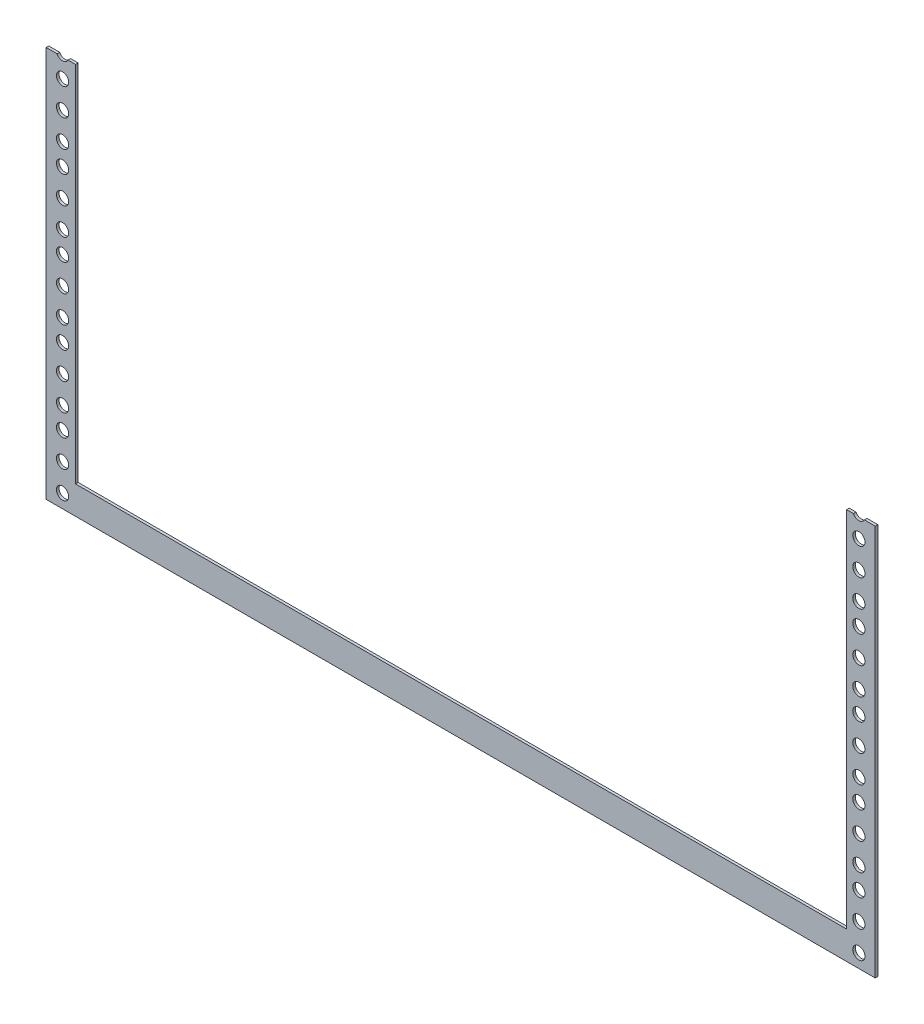
from build123d import *

# Parameters (mm, degrees)
SKETCH1_W          = 484.1875
SKETCH1_H          = 1958.975
SKETCH1_R          = 3.571875
SKETCH1_W_2        = 450.402529245
SKETCH1_H_2        = 1922.114390918
BASE_FLANGE1_DEPTH = 1.524
SKETCH2_W          = 484.1875
SKETCH2_H          = 1730.375
EXTRUDE1_DEPTH     = 2129.3640217


# Sheet-metal steps are written as plain solids
with BuildPart() as part:
    # Sketch1 → Base-Flange1 (new body)
    with BuildSketch(Plane.XY):
        with Locations((0, 1135.0625)):
            Rectangle(SKETCH1_W, SKETCH1_H)
        with Locations(Location((-232.56875, 284.1625, 0), (0, 0, 180))):
            Circle(SKETCH1_R, mode=Mode.SUBTRACT)
        with Locations(Location((-232.56875, 239.7125, 0), (0, 0, 180))):
            Circle(SKETCH1_R, mode=Mode.SUBTRACT)
        with Locations(Location((-232.56875, 252.4125, 0), (0, 0, 180))):
            Circle(SKETCH1_R, mode=Mode.SUBTRACT)
        with Locations(Location((-232.56875, 268.2875, 0), (0, 0, 180))):
            Circle(SKETCH1_R, mode=Mode.SUBTRACT)
        with Locations(Location((-232.56875, 207.9625, 0), (0, 0, 180))):
            Circle(SKETCH1_R, mode=Mode.SUBTRACT)
        with Locations(Location((-232.56875, 195.2625, 0), (0, 0, 180))):
            Circle(SKETCH1_R, mode=Mode.SUBTRACT)
        with Locations(Location((-232.56875, 179.3875, 0), (0, 0, 180))):
            Circle(SKETCH1_R, mode=Mode.SUBTRACT)
        with Locations(Location((-232.56875, 163.5125, 0), (0, 0, 180))):
            Circle(SKETCH1_R, mode=Mode.SUBTRACT)
        with Locations(Location((-232.56875, 223.8375, 0), (0, 0, 180))):
            Circle(SKETCH1_R, mode=Mode.SUBTRACT)
        with Locations(Location((-232.56875, 417.5125, 0), (0, 0, 180))):
            Circle(SKETCH1_R, mode=Mode.SUBTRACT)
        with Locations(Location((-232.56875, 401.6375, 0), (0, 0, 180))):
            Circle(SKETCH1_R, mode=Mode.SUBTRACT)
        with Locations(Location((-232.56875, 373.0625, 0), (0, 0, 180))):
            Circle(SKETCH1_R, mode=Mode.SUBTRACT)
        with Locations(Location((-232.56875, 385.7625, 0), (0, 0, 180))):
            Circle(SKETCH1_R, mode=Mode.SUBTRACT)
        with Locations(Location((-232.56875, 312.7375, 0), (0, 0, 180))):
            Circle(SKETCH1_R, mode=Mode.SUBTRACT)
        with Locations(Location((-232.56875, 296.8625, 0), (0, 0, 180))):
            Circle(SKETCH1_R, mode=Mode.SUBTRACT)
        with Locations(Location((-232.56875, 328.6125, 0), (0, 0, 180))):
            Circle(SKETCH1_R, mode=Mode.SUBTRACT)
        with Locations(Location((-232.56875, 341.3125, 0), (0, 0, 180))):
            Circle(SKETCH1_R, mode=Mode.SUBTRACT)
        with Locations(Location((-232.56875, 357.1875, 0), (0, 0, 180))):
            Circle(SKETCH1_R, mode=Mode.SUBTRACT)
        with Locations(Location((-232.56875, 506.4125, 0), (0, 0, 180))):
            Circle(SKETCH1_R, mode=Mode.SUBTRACT)
        with Locations(Location((-232.56875, 534.9875, 0), (0, 0, 180))):
            Circle(SKETCH1_R, mode=Mode.SUBTRACT)
        with Locations(Location((-232.56875, 519.1125, 0), (0, 0, 180))):
            Circle(SKETCH1_R, mode=Mode.SUBTRACT)
        with Locations(Location((-232.56875, 446.0875, 0), (0, 0, 180))):
            Circle(SKETCH1_R, mode=Mode.SUBTRACT)
        with Locations(Location((-232.56875, 461.9625, 0), (0, 0, 180))):
            Circle(SKETCH1_R, mode=Mode.SUBTRACT)
        with Locations(Location((-232.56875, 430.2125, 0), (0, 0, 180))):
            Circle(SKETCH1_R, mode=Mode.SUBTRACT)
        with Locations(Location((-232.56875, 474.6625, 0), (0, 0, 180))):
            Circle(SKETCH1_R, mode=Mode.SUBTRACT)
        with Locations(Location((-232.56875, 490.5375, 0), (0, 0, 180))):
            Circle(SKETCH1_R, mode=Mode.SUBTRACT)
        with Locations(Location((232.56875, 284.1625, 0), (0, 0, 180))):
            Circle(SKETCH1_R, mode=Mode.SUBTRACT)
        with Locations(Location((232.56875, 239.7125, 0), (0, 0, 180))):
            Circle(SKETCH1_R, mode=Mode.SUBTRACT)
        with Locations(Location((232.56875, 252.4125, 0), (0, 0, 180))):
            Circle(SKETCH1_R, mode=Mode.SUBTRACT)
        with Locations(Location((232.56875, 268.2875, 0), (0, 0, 180))):
            Circle(SKETCH1_R, mode=Mode.SUBTRACT)
        with Locations(Location((232.56875, 207.9625, 0), (0, 0, 180))):
            Circle(SKETCH1_R, mode=Mode.SUBTRACT)
        with Locations(Location((232.56875, 179.3875, 0), (0, 0, 180))):
            Circle(SKETCH1_R, mode=Mode.SUBTRACT)
        with Locations(Location((232.56875, 195.2625, 0), (0, 0, 180))):
            Circle(SKETCH1_R, mode=Mode.SUBTRACT)
        with Locations(Location((232.56875, 163.5125, 0), (0, 0, 180))):
            Circle(SKETCH1_R, mode=Mode.SUBTRACT)
        with Locations(Location((232.56875, 223.8375, 0), (0, 0, 180))):
            Circle(SKETCH1_R, mode=Mode.SUBTRACT)
        with Locations(Location((232.56875, 417.5125, 0), (0, 0, 180))):
            Circle(SKETCH1_R, mode=Mode.SUBTRACT)
        with Locations(Location((232.56875, 401.6375, 0), (0, 0, 180))):
            Circle(SKETCH1_R, mode=Mode.SUBTRACT)
        with Locations(Location((232.56875, 373.0625, 0), (0, 0, 180))):
            Circle(SKETCH1_R, mode=Mode.SUBTRACT)
        with Locations(Location((232.56875, 385.7625, 0), (0, 0, 180))):
            Circle(SKETCH1_R, mode=Mode.SUBTRACT)
        with Locations(Location((232.56875, 312.7375, 0), (0, 0, 180))):
            Circle(SKETCH1_R, mode=Mode.SUBTRACT)
        with Locations(Location((232.56875, 296.8625, 0), (0, 0, 180))):
            Circle(SKETCH1_R, mode=Mode.SUBTRACT)
        with Locations(Location((232.56875, 328.6125, 0), (0, 0, 180))):
            Circle(SKETCH1_R, mode=Mode.SUBTRACT)
        with Locations(Location((232.56875, 357.1875, 0), (0, 0, 180))):
            Circle(SKETCH1_R, mode=Mode.SUBTRACT)
        with Locations(Location((232.56875, 341.3125, 0), (0, 0, 180))):
            Circle(SKETCH1_R, mode=Mode.SUBTRACT)
        with Locations(Location((232.56875, 506.4125, 0), (0, 0, 180))):
            Circle(SKETCH1_R, mode=Mode.SUBTRACT)
        with Locations(Location((232.56875, 534.9875, 0), (0, 0, 180))):
            Circle(SKETCH1_R, mode=Mode.SUBTRACT)
        with Locations(Location((232.56875, 519.1125, 0), (0, 0, 180))):
            Circle(SKETCH1_R, mode=Mode.SUBTRACT)
        with Locations(Location((232.56875, 461.9625, 0), (0, 0, 180))):
            Circle(SKETCH1_R, mode=Mode.SUBTRACT)
        with Locations(Location((232.56875, 446.0875, 0), (0, 0, 180))):
            Circle(SKETCH1_R, mode=Mode.SUBTRACT)
        with Locations(Location((232.56875, 430.2125, 0), (0, 0, 180))):
            Circle(SKETCH1_R, mode=Mode.SUBTRACT)
        with Locations(Location((232.56875, 474.6625, 0), (0, 0, 180))):
            Circle(SKETCH1_R, mode=Mode.SUBTRACT)
        with Locations(Location((232.56875, 490.5375, 0), (0, 0, 180))):
            Circle(SKETCH1_R, mode=Mode.SUBTRACT)
        with Locations(Location((-232.56875, 801.6875, 0), (0, 0, 180))):
            Circle(SKETCH1_R, mode=Mode.SUBTRACT)
        with Locations(Location((-232.56875, 639.7625, 0), (0, 0, 180))):
            Circle(SKETCH1_R, mode=Mode.SUBTRACT)
        with Locations(Location((-232.56875, 652.4625, 0), (0, 0, 180))):
            Circle(SKETCH1_R, mode=Mode.SUBTRACT)
        with Locations(Location((-232.56875, 668.3375, 0), (0, 0, 180))):
            Circle(SKETCH1_R, mode=Mode.SUBTRACT)
        with Locations(Location((-232.56875, 550.8625, 0), (0, 0, 180))):
            Circle(SKETCH1_R, mode=Mode.SUBTRACT)
        with Locations(Location((-232.56875, 579.4375, 0), (0, 0, 180))):
            Circle(SKETCH1_R, mode=Mode.SUBTRACT)
        with Locations(Location((-232.56875, 595.3125, 0), (0, 0, 180))):
            Circle(SKETCH1_R, mode=Mode.SUBTRACT)
        with Locations(Location((-232.56875, 563.5625, 0), (0, 0, 180))):
            Circle(SKETCH1_R, mode=Mode.SUBTRACT)
        with Locations(Location((-232.56875, 608.0125, 0), (0, 0, 180))):
            Circle(SKETCH1_R, mode=Mode.SUBTRACT)
        with Locations(Location((-232.56875, 623.8875, 0), (0, 0, 180))):
            Circle(SKETCH1_R, mode=Mode.SUBTRACT)
        with Locations(Location((-232.56875, 757.2375, 0), (0, 0, 180))):
            Circle(SKETCH1_R, mode=Mode.SUBTRACT)
        with Locations(Location((-232.56875, 773.1125, 0), (0, 0, 180))):
            Circle(SKETCH1_R, mode=Mode.SUBTRACT)
        with Locations(Location((-232.56875, 785.8125, 0), (0, 0, 180))):
            Circle(SKETCH1_R, mode=Mode.SUBTRACT)
        with Locations(Location((-232.56875, 712.7875, 0), (0, 0, 180))):
            Circle(SKETCH1_R, mode=Mode.SUBTRACT)
        with Locations(Location((-232.56875, 684.2125, 0), (0, 0, 180))):
            Circle(SKETCH1_R, mode=Mode.SUBTRACT)
        with Locations(Location((-232.56875, 696.9125, 0), (0, 0, 180))):
            Circle(SKETCH1_R, mode=Mode.SUBTRACT)
        with Locations(Location((-232.56875, 728.6625, 0), (0, 0, 180))):
            Circle(SKETCH1_R, mode=Mode.SUBTRACT)
        with Locations(Location((-232.56875, 741.3625, 0), (0, 0, 180))):
            Circle(SKETCH1_R, mode=Mode.SUBTRACT)
        with Locations(Location((-232.56875, 935.0375, 0), (0, 0, 180))):
            Circle(SKETCH1_R, mode=Mode.SUBTRACT)
        with Locations(Location((-232.56875, 906.4625, 0), (0, 0, 180))):
            Circle(SKETCH1_R, mode=Mode.SUBTRACT)
        with Locations(Location((-232.56875, 919.1625, 0), (0, 0, 180))):
            Circle(SKETCH1_R, mode=Mode.SUBTRACT)
        with Locations(Location((-232.56875, 890.5875, 0), (0, 0, 180))):
            Circle(SKETCH1_R, mode=Mode.SUBTRACT)
        with Locations(Location((-232.56875, 830.2625, 0), (0, 0, 180))):
            Circle(SKETCH1_R, mode=Mode.SUBTRACT)
        with Locations(Location((-232.56875, 817.5625, 0), (0, 0, 180))):
            Circle(SKETCH1_R, mode=Mode.SUBTRACT)
        with Locations(Location((-232.56875, 846.1375, 0), (0, 0, 180))):
            Circle(SKETCH1_R, mode=Mode.SUBTRACT)
        with Locations(Location((-232.56875, 862.0125, 0), (0, 0, 180))):
            Circle(SKETCH1_R, mode=Mode.SUBTRACT)
        with Locations(Location((-232.56875, 874.7125, 0), (0, 0, 180))):
            Circle(SKETCH1_R, mode=Mode.SUBTRACT)
        with Locations(Location((-232.56875, 1052.5125, 0), (0, 0, 180))):
            Circle(SKETCH1_R, mode=Mode.SUBTRACT)
        with Locations(Location((-232.56875, 1023.9375, 0), (0, 0, 180))):
            Circle(SKETCH1_R, mode=Mode.SUBTRACT)
        with Locations(Location((-232.56875, 1039.8125, 0), (0, 0, 180))):
            Circle(SKETCH1_R, mode=Mode.SUBTRACT)
        with Locations(Location((-232.56875, 950.9125, 0), (0, 0, 180))):
            Circle(SKETCH1_R, mode=Mode.SUBTRACT)
        with Locations(Location((-232.56875, 963.6125, 0), (0, 0, 180))):
            Circle(SKETCH1_R, mode=Mode.SUBTRACT)
        with Locations(Location((-232.56875, 979.4875, 0), (0, 0, 180))):
            Circle(SKETCH1_R, mode=Mode.SUBTRACT)
        with Locations(Location((-232.56875, 995.3625, 0), (0, 0, 180))):
            Circle(SKETCH1_R, mode=Mode.SUBTRACT)
        with Locations(Location((-232.56875, 1008.0625, 0), (0, 0, 180))):
            Circle(SKETCH1_R, mode=Mode.SUBTRACT)
        with Locations(Location((232.56875, 801.6875, 0), (0, 0, 180))):
            Circle(SKETCH1_R, mode=Mode.SUBTRACT)
        with Locations(Location((232.56875, 639.7625, 0), (0, 0, 180))):
            Circle(SKETCH1_R, mode=Mode.SUBTRACT)
        with Locations(Location((232.56875, 652.4625, 0), (0, 0, 180))):
            Circle(SKETCH1_R, mode=Mode.SUBTRACT)
        with Locations(Location((232.56875, 668.3375, 0), (0, 0, 180))):
            Circle(SKETCH1_R, mode=Mode.SUBTRACT)
        with Locations(Location((232.56875, 550.8625, 0), (0, 0, 180))):
            Circle(SKETCH1_R, mode=Mode.SUBTRACT)
        with Locations(Location((232.56875, 595.3125, 0), (0, 0, 180))):
            Circle(SKETCH1_R, mode=Mode.SUBTRACT)
        with Locations(Location((232.56875, 579.4375, 0), (0, 0, 180))):
            Circle(SKETCH1_R, mode=Mode.SUBTRACT)
        with Locations(Location((232.56875, 563.5625, 0), (0, 0, 180))):
            Circle(SKETCH1_R, mode=Mode.SUBTRACT)
        with Locations(Location((232.56875, 608.0125, 0), (0, 0, 180))):
            Circle(SKETCH1_R, mode=Mode.SUBTRACT)
        with Locations(Location((232.56875, 623.8875, 0), (0, 0, 180))):
            Circle(SKETCH1_R, mode=Mode.SUBTRACT)
        with Locations(Location((232.56875, 773.1125, 0), (0, 0, 180))):
            Circle(SKETCH1_R, mode=Mode.SUBTRACT)
        with Locations(Location((232.56875, 757.2375, 0), (0, 0, 180))):
            Circle(SKETCH1_R, mode=Mode.SUBTRACT)
        with Locations(Location((232.56875, 785.8125, 0), (0, 0, 180))):
            Circle(SKETCH1_R, mode=Mode.SUBTRACT)
        with Locations(Location((232.56875, 712.7875, 0), (0, 0, 180))):
            Circle(SKETCH1_R, mode=Mode.SUBTRACT)
        with Locations(Location((232.56875, 684.2125, 0), (0, 0, 180))):
            Circle(SKETCH1_R, mode=Mode.SUBTRACT)
        with Locations(Location((232.56875, 696.9125, 0), (0, 0, 180))):
            Circle(SKETCH1_R, mode=Mode.SUBTRACT)
        with Locations(Location((232.56875, 728.6625, 0), (0, 0, 180))):
            Circle(SKETCH1_R, mode=Mode.SUBTRACT)
        with Locations(Location((232.56875, 741.3625, 0), (0, 0, 180))):
            Circle(SKETCH1_R, mode=Mode.SUBTRACT)
        with Locations(Location((232.56875, 935.0375, 0), (0, 0, 180))):
            Circle(SKETCH1_R, mode=Mode.SUBTRACT)
        with Locations(Location((232.56875, 906.4625, 0), (0, 0, 180))):
            Circle(SKETCH1_R, mode=Mode.SUBTRACT)
        with Locations(Location((232.56875, 919.1625, 0), (0, 0, 180))):
            Circle(SKETCH1_R, mode=Mode.SUBTRACT)
        with Locations(Location((232.56875, 890.5875, 0), (0, 0, 180))):
            Circle(SKETCH1_R, mode=Mode.SUBTRACT)
        with Locations(Location((232.56875, 830.2625, 0), (0, 0, 180))):
            Circle(SKETCH1_R, mode=Mode.SUBTRACT)
        with Locations(Location((232.56875, 817.5625, 0), (0, 0, 180))):
            Circle(SKETCH1_R, mode=Mode.SUBTRACT)
        with Locations(Location((232.56875, 862.0125, 0), (0, 0, 180))):
            Circle(SKETCH1_R, mode=Mode.SUBTRACT)
        with Locations(Location((232.56875, 846.1375, 0), (0, 0, 180))):
            Circle(SKETCH1_R, mode=Mode.SUBTRACT)
        with Locations(Location((232.56875, 874.7125, 0), (0, 0, 180))):
            Circle(SKETCH1_R, mode=Mode.SUBTRACT)
        with Locations(Location((232.56875, 1052.5125, 0), (0, 0, 180))):
            Circle(SKETCH1_R, mode=Mode.SUBTRACT)
        with Locations(Location((232.56875, 1039.8125, 0), (0, 0, 180))):
            Circle(SKETCH1_R, mode=Mode.SUBTRACT)
        with Locations(Location((232.56875, 1023.9375, 0), (0, 0, 180))):
            Circle(SKETCH1_R, mode=Mode.SUBTRACT)
        with Locations(Location((232.56875, 950.9125, 0), (0, 0, 180))):
            Circle(SKETCH1_R, mode=Mode.SUBTRACT)
        with Locations(Location((232.56875, 995.3625, 0), (0, 0, 180))):
            Circle(SKETCH1_R, mode=Mode.SUBTRACT)
        with Locations(Location((232.56875, 979.4875, 0), (0, 0, 180))):
            Circle(SKETCH1_R, mode=Mode.SUBTRACT)
        with Locations(Location((232.56875, 963.6125, 0), (0, 0, 180))):
            Circle(SKETCH1_R, mode=Mode.SUBTRACT)
        with Locations(Location((232.56875, 1008.0625, 0), (0, 0, 180))):
            Circle(SKETCH1_R, mode=Mode.SUBTRACT)
        with Locations(Location((-232.56875, 1319.2125, 0), (0, 0, 180))):
            Circle(SKETCH1_R, mode=Mode.SUBTRACT)
        with Locations(Location((-232.56875, 1157.2875, 0), (0, 0, 180))):
            Circle(SKETCH1_R, mode=Mode.SUBTRACT)
        with Locations(Location((-232.56875, 1173.1625, 0), (0, 0, 180))):
            Circle(SKETCH1_R, mode=Mode.SUBTRACT)
        with Locations(Location((-232.56875, 1185.8625, 0), (0, 0, 180))):
            Circle(SKETCH1_R, mode=Mode.SUBTRACT)
        with Locations(Location((-232.56875, 1128.7125, 0), (0, 0, 180))):
            Circle(SKETCH1_R, mode=Mode.SUBTRACT)
        with Locations(Location((-232.56875, 1096.9625, 0), (0, 0, 180))):
            Circle(SKETCH1_R, mode=Mode.SUBTRACT)
        with Locations(Location((-232.56875, 1068.3875, 0), (0, 0, 180))):
            Circle(SKETCH1_R, mode=Mode.SUBTRACT)
        with Locations(Location((-232.56875, 1084.2625, 0), (0, 0, 180))):
            Circle(SKETCH1_R, mode=Mode.SUBTRACT)
        with Locations(Location((-232.56875, 1112.8375, 0), (0, 0, 180))):
            Circle(SKETCH1_R, mode=Mode.SUBTRACT)
        with Locations(Location((-232.56875, 1141.4125, 0), (0, 0, 180))):
            Circle(SKETCH1_R, mode=Mode.SUBTRACT)
        with Locations(Location((-232.56875, 1274.7625, 0), (0, 0, 180))):
            Circle(SKETCH1_R, mode=Mode.SUBTRACT)
        with Locations(Location((-232.56875, 1290.6375, 0), (0, 0, 180))):
            Circle(SKETCH1_R, mode=Mode.SUBTRACT)
        with Locations(Location((-232.56875, 1306.5125, 0), (0, 0, 180))):
            Circle(SKETCH1_R, mode=Mode.SUBTRACT)
        with Locations(Location((-232.56875, 1246.1875, 0), (0, 0, 180))):
            Circle(SKETCH1_R, mode=Mode.SUBTRACT)
        with Locations(Location((-232.56875, 1262.0625, 0), (0, 0, 180))):
            Circle(SKETCH1_R, mode=Mode.SUBTRACT)
        with Locations(Location((-232.56875, 1201.7375, 0), (0, 0, 180))):
            Circle(SKETCH1_R, mode=Mode.SUBTRACT)
        with Locations(Location((-232.56875, 1217.6125, 0), (0, 0, 180))):
            Circle(SKETCH1_R, mode=Mode.SUBTRACT)
        with Locations(Location((-232.56875, 1230.3125, 0), (0, 0, 180))):
            Circle(SKETCH1_R, mode=Mode.SUBTRACT)
        with Locations(Location((-232.56875, 1452.5625, 0), (0, 0, 180))):
            Circle(SKETCH1_R, mode=Mode.SUBTRACT)
        with Locations(Location((-232.56875, 1408.1125, 0), (0, 0, 180))):
            Circle(SKETCH1_R, mode=Mode.SUBTRACT)
        with Locations(Location((-232.56875, 1423.9875, 0), (0, 0, 180))):
            Circle(SKETCH1_R, mode=Mode.SUBTRACT)
        with Locations(Location((-232.56875, 1439.8625, 0), (0, 0, 180))):
            Circle(SKETCH1_R, mode=Mode.SUBTRACT)
        with Locations(Location((-232.56875, 1379.5375, 0), (0, 0, 180))):
            Circle(SKETCH1_R, mode=Mode.SUBTRACT)
        with Locations(Location((-232.56875, 1350.9625, 0), (0, 0, 180))):
            Circle(SKETCH1_R, mode=Mode.SUBTRACT)
        with Locations(Location((-232.56875, 1363.6625, 0), (0, 0, 180))):
            Circle(SKETCH1_R, mode=Mode.SUBTRACT)
        with Locations(Location((-232.56875, 1335.0875, 0), (0, 0, 180))):
            Circle(SKETCH1_R, mode=Mode.SUBTRACT)
        with Locations(Location((-232.56875, 1395.4125, 0), (0, 0, 180))):
            Circle(SKETCH1_R, mode=Mode.SUBTRACT)
        with Locations(Location((-232.56875, 1573.2125, 0), (0, 0, 180))):
            Circle(SKETCH1_R, mode=Mode.SUBTRACT)
        with Locations(Location((-232.56875, 1541.4625, 0), (0, 0, 180))):
            Circle(SKETCH1_R, mode=Mode.SUBTRACT)
        with Locations(Location((-232.56875, 1557.3375, 0), (0, 0, 180))):
            Circle(SKETCH1_R, mode=Mode.SUBTRACT)
        with Locations(Location((-232.56875, 1497.0125, 0), (0, 0, 180))):
            Circle(SKETCH1_R, mode=Mode.SUBTRACT)
        with Locations(Location((-232.56875, 1468.4375, 0), (0, 0, 180))):
            Circle(SKETCH1_R, mode=Mode.SUBTRACT)
        with Locations(Location((-232.56875, 1484.3125, 0), (0, 0, 180))):
            Circle(SKETCH1_R, mode=Mode.SUBTRACT)
        with Locations(Location((-232.56875, 1512.8875, 0), (0, 0, 180))):
            Circle(SKETCH1_R, mode=Mode.SUBTRACT)
        with Locations(Location((-232.56875, 1528.7625, 0), (0, 0, 180))):
            Circle(SKETCH1_R, mode=Mode.SUBTRACT)
        with Locations(Location((232.56875, 1319.2125, 0), (0, 0, 180))):
            Circle(SKETCH1_R, mode=Mode.SUBTRACT)
        with Locations(Location((232.56875, 1157.2875, 0), (0, 0, 180))):
            Circle(SKETCH1_R, mode=Mode.SUBTRACT)
        with Locations(Location((232.56875, 1173.1625, 0), (0, 0, 180))):
            Circle(SKETCH1_R, mode=Mode.SUBTRACT)
        with Locations(Location((232.56875, 1185.8625, 0), (0, 0, 180))):
            Circle(SKETCH1_R, mode=Mode.SUBTRACT)
        with Locations(Location((232.56875, 1128.7125, 0), (0, 0, 180))):
            Circle(SKETCH1_R, mode=Mode.SUBTRACT)
        with Locations(Location((232.56875, 1084.2625, 0), (0, 0, 180))):
            Circle(SKETCH1_R, mode=Mode.SUBTRACT)
        with Locations(Location((232.56875, 1068.3875, 0), (0, 0, 180))):
            Circle(SKETCH1_R, mode=Mode.SUBTRACT)
        with Locations(Location((232.56875, 1096.9625, 0), (0, 0, 180))):
            Circle(SKETCH1_R, mode=Mode.SUBTRACT)
        with Locations(Location((232.56875, 1112.8375, 0), (0, 0, 180))):
            Circle(SKETCH1_R, mode=Mode.SUBTRACT)
        with Locations(Location((232.56875, 1141.4125, 0), (0, 0, 180))):
            Circle(SKETCH1_R, mode=Mode.SUBTRACT)
        with Locations(Location((232.56875, 1274.7625, 0), (0, 0, 180))):
            Circle(SKETCH1_R, mode=Mode.SUBTRACT)
        with Locations(Location((232.56875, 1306.5125, 0), (0, 0, 180))):
            Circle(SKETCH1_R, mode=Mode.SUBTRACT)
        with Locations(Location((232.56875, 1290.6375, 0), (0, 0, 180))):
            Circle(SKETCH1_R, mode=Mode.SUBTRACT)
        with Locations(Location((232.56875, 1262.0625, 0), (0, 0, 180))):
            Circle(SKETCH1_R, mode=Mode.SUBTRACT)
        with Locations(Location((232.56875, 1246.1875, 0), (0, 0, 180))):
            Circle(SKETCH1_R, mode=Mode.SUBTRACT)
        with Locations(Location((232.56875, 1217.6125, 0), (0, 0, 180))):
            Circle(SKETCH1_R, mode=Mode.SUBTRACT)
        with Locations(Location((232.56875, 1201.7375, 0), (0, 0, 180))):
            Circle(SKETCH1_R, mode=Mode.SUBTRACT)
        with Locations(Location((232.56875, 1230.3125, 0), (0, 0, 180))):
            Circle(SKETCH1_R, mode=Mode.SUBTRACT)
        with Locations(Location((232.56875, 1452.5625, 0), (0, 0, 180))):
            Circle(SKETCH1_R, mode=Mode.SUBTRACT)
        with Locations(Location((232.56875, 1439.8625, 0), (0, 0, 180))):
            Circle(SKETCH1_R, mode=Mode.SUBTRACT)
        with Locations(Location((232.56875, 1423.9875, 0), (0, 0, 180))):
            Circle(SKETCH1_R, mode=Mode.SUBTRACT)
        with Locations(Location((232.56875, 1408.1125, 0), (0, 0, 180))):
            Circle(SKETCH1_R, mode=Mode.SUBTRACT)
        with Locations(Location((232.56875, 1379.5375, 0), (0, 0, 180))):
            Circle(SKETCH1_R, mode=Mode.SUBTRACT)
        with Locations(Location((232.56875, 1350.9625, 0), (0, 0, 180))):
            Circle(SKETCH1_R, mode=Mode.SUBTRACT)
        with Locations(Location((232.56875, 1363.6625, 0), (0, 0, 180))):
            Circle(SKETCH1_R, mode=Mode.SUBTRACT)
        with Locations(Location((232.56875, 1335.0875, 0), (0, 0, 180))):
            Circle(SKETCH1_R, mode=Mode.SUBTRACT)
        with Locations(Location((232.56875, 1395.4125, 0), (0, 0, 180))):
            Circle(SKETCH1_R, mode=Mode.SUBTRACT)
        with Locations(Location((232.56875, 1573.2125, 0), (0, 0, 180))):
            Circle(SKETCH1_R, mode=Mode.SUBTRACT)
        with Locations(Location((232.56875, 1541.4625, 0), (0, 0, 180))):
            Circle(SKETCH1_R, mode=Mode.SUBTRACT)
        with Locations(Location((232.56875, 1557.3375, 0), (0, 0, 180))):
            Circle(SKETCH1_R, mode=Mode.SUBTRACT)
        with Locations(Location((232.56875, 1497.0125, 0), (0, 0, 180))):
            Circle(SKETCH1_R, mode=Mode.SUBTRACT)
        with Locations(Location((232.56875, 1484.3125, 0), (0, 0, 180))):
            Circle(SKETCH1_R, mode=Mode.SUBTRACT)
        with Locations(Location((232.56875, 1468.4375, 0), (0, 0, 180))):
            Circle(SKETCH1_R, mode=Mode.SUBTRACT)
        with Locations(Location((232.56875, 1512.8875, 0), (0, 0, 180))):
            Circle(SKETCH1_R, mode=Mode.SUBTRACT)
        with Locations(Location((232.56875, 1528.7625, 0), (0, 0, 180))):
            Circle(SKETCH1_R, mode=Mode.SUBTRACT)
        with Locations(Location((-232.56875, 1839.9125, 0), (0, 0, 180))):
            Circle(SKETCH1_R, mode=Mode.SUBTRACT)
        with Locations(Location((-232.56875, 1706.5625, 0), (0, 0, 180))):
            Circle(SKETCH1_R, mode=Mode.SUBTRACT)
        with Locations(Location((-232.56875, 1662.1125, 0), (0, 0, 180))):
            Circle(SKETCH1_R, mode=Mode.SUBTRACT)
        with Locations(Location((-232.56875, 1690.6875, 0), (0, 0, 180))):
            Circle(SKETCH1_R, mode=Mode.SUBTRACT)
        with Locations(Location((-232.56875, 1674.8125, 0), (0, 0, 180))):
            Circle(SKETCH1_R, mode=Mode.SUBTRACT)
        with Locations(Location((-232.56875, 1601.7875, 0), (0, 0, 180))):
            Circle(SKETCH1_R, mode=Mode.SUBTRACT)
        with Locations(Location((-232.56875, 1585.9125, 0), (0, 0, 180))):
            Circle(SKETCH1_R, mode=Mode.SUBTRACT)
        with Locations(Location((-232.56875, 1617.6625, 0), (0, 0, 180))):
            Circle(SKETCH1_R, mode=Mode.SUBTRACT)
        with Locations(Location((-232.56875, 1646.2375, 0), (0, 0, 180))):
            Circle(SKETCH1_R, mode=Mode.SUBTRACT)
        with Locations(Location((-232.56875, 1630.3625, 0), (0, 0, 180))):
            Circle(SKETCH1_R, mode=Mode.SUBTRACT)
        with Locations(Location((-232.56875, 1795.4625, 0), (0, 0, 180))):
            Circle(SKETCH1_R, mode=Mode.SUBTRACT)
        with Locations(Location((-232.56875, 1808.1625, 0), (0, 0, 180))):
            Circle(SKETCH1_R, mode=Mode.SUBTRACT)
        with Locations(Location((-232.56875, 1824.0375, 0), (0, 0, 180))):
            Circle(SKETCH1_R, mode=Mode.SUBTRACT)
        with Locations(Location((-232.56875, 1779.5875, 0), (0, 0, 180))):
            Circle(SKETCH1_R, mode=Mode.SUBTRACT)
        with Locations(Location((-232.56875, 1751.0125, 0), (0, 0, 180))):
            Circle(SKETCH1_R, mode=Mode.SUBTRACT)
        with Locations(Location((-232.56875, 1719.2625, 0), (0, 0, 180))):
            Circle(SKETCH1_R, mode=Mode.SUBTRACT)
        with Locations(Location((-232.56875, 1735.1375, 0), (0, 0, 180))):
            Circle(SKETCH1_R, mode=Mode.SUBTRACT)
        with Locations(Location((-232.56875, 1763.7125, 0), (0, 0, 180))):
            Circle(SKETCH1_R, mode=Mode.SUBTRACT)
        with Locations(Location((-232.56875, 1928.8125, 0), (0, 0, 180))):
            Circle(SKETCH1_R, mode=Mode.SUBTRACT)
        with Locations(Location((-232.56875, 1941.5125, 0), (0, 0, 180))):
            Circle(SKETCH1_R, mode=Mode.SUBTRACT)
        with Locations(Location((-232.56875, 1957.3875, 0), (0, 0, 180))):
            Circle(SKETCH1_R, mode=Mode.SUBTRACT)
        with Locations(Location((-232.56875, 1897.0625, 0), (0, 0, 180))):
            Circle(SKETCH1_R, mode=Mode.SUBTRACT)
        with Locations(Location((-232.56875, 1868.4875, 0), (0, 0, 180))):
            Circle(SKETCH1_R, mode=Mode.SUBTRACT)
        with Locations(Location((-232.56875, 1884.3625, 0), (0, 0, 180))):
            Circle(SKETCH1_R, mode=Mode.SUBTRACT)
        with Locations(Location((-232.56875, 1852.6125, 0), (0, 0, 180))):
            Circle(SKETCH1_R, mode=Mode.SUBTRACT)
        with Locations(Location((-232.56875, 1912.9375, 0), (0, 0, 180))):
            Circle(SKETCH1_R, mode=Mode.SUBTRACT)
        with Locations(Location((-232.56875, 2090.7375, 0), (0, 0, 180))):
            Circle(SKETCH1_R, mode=Mode.SUBTRACT)
        with Locations(Location((-232.56875, 2062.1625, 0), (0, 0, 180))):
            Circle(SKETCH1_R, mode=Mode.SUBTRACT)
        with Locations(Location((-232.56875, 2074.8625, 0), (0, 0, 180))):
            Circle(SKETCH1_R, mode=Mode.SUBTRACT)
        with Locations(Location((-232.56875, 2001.8375, 0), (0, 0, 180))):
            Circle(SKETCH1_R, mode=Mode.SUBTRACT)
        with Locations(Location((-232.56875, 1973.2625, 0), (0, 0, 180))):
            Circle(SKETCH1_R, mode=Mode.SUBTRACT)
        with Locations(Location((-232.56875, 1985.9625, 0), (0, 0, 180))):
            Circle(SKETCH1_R, mode=Mode.SUBTRACT)
        with Locations(Location((-232.56875, 2017.7125, 0), (0, 0, 180))):
            Circle(SKETCH1_R, mode=Mode.SUBTRACT)
        with Locations(Location((-232.56875, 2030.4125, 0), (0, 0, 180))):
            Circle(SKETCH1_R, mode=Mode.SUBTRACT)
        with Locations(Location((-232.56875, 2046.2875, 0), (0, 0, 180))):
            Circle(SKETCH1_R, mode=Mode.SUBTRACT)
        with Locations(Location((232.56875, 1839.9125, 0), (0, 0, 180))):
            Circle(SKETCH1_R, mode=Mode.SUBTRACT)
        with Locations(Location((232.56875, 1706.5625, 0), (0, 0, 180))):
            Circle(SKETCH1_R, mode=Mode.SUBTRACT)
        with Locations(Location((232.56875, 1662.1125, 0), (0, 0, 180))):
            Circle(SKETCH1_R, mode=Mode.SUBTRACT)
        with Locations(Location((232.56875, 1690.6875, 0), (0, 0, 180))):
            Circle(SKETCH1_R, mode=Mode.SUBTRACT)
        with Locations(Location((232.56875, 1674.8125, 0), (0, 0, 180))):
            Circle(SKETCH1_R, mode=Mode.SUBTRACT)
        with Locations(Location((232.56875, 1601.7875, 0), (0, 0, 180))):
            Circle(SKETCH1_R, mode=Mode.SUBTRACT)
        with Locations(Location((232.56875, 1585.9125, 0), (0, 0, 180))):
            Circle(SKETCH1_R, mode=Mode.SUBTRACT)
        with Locations(Location((232.56875, 1617.6625, 0), (0, 0, 180))):
            Circle(SKETCH1_R, mode=Mode.SUBTRACT)
        with Locations(Location((232.56875, 1646.2375, 0), (0, 0, 180))):
            Circle(SKETCH1_R, mode=Mode.SUBTRACT)
        with Locations(Location((232.56875, 1630.3625, 0), (0, 0, 180))):
            Circle(SKETCH1_R, mode=Mode.SUBTRACT)
        with Locations(Location((232.56875, 1795.4625, 0), (0, 0, 180))):
            Circle(SKETCH1_R, mode=Mode.SUBTRACT)
        with Locations(Location((232.56875, 1824.0375, 0), (0, 0, 180))):
            Circle(SKETCH1_R, mode=Mode.SUBTRACT)
        with Locations(Location((232.56875, 1808.1625, 0), (0, 0, 180))):
            Circle(SKETCH1_R, mode=Mode.SUBTRACT)
        with Locations(Location((232.56875, 1779.5875, 0), (0, 0, 180))):
            Circle(SKETCH1_R, mode=Mode.SUBTRACT)
        with Locations(Location((232.56875, 1751.0125, 0), (0, 0, 180))):
            Circle(SKETCH1_R, mode=Mode.SUBTRACT)
        with Locations(Location((232.56875, 1719.2625, 0), (0, 0, 180))):
            Circle(SKETCH1_R, mode=Mode.SUBTRACT)
        with Locations(Location((232.56875, 1735.1375, 0), (0, 0, 180))):
            Circle(SKETCH1_R, mode=Mode.SUBTRACT)
        with Locations(Location((232.56875, 1763.7125, 0), (0, 0, 180))):
            Circle(SKETCH1_R, mode=Mode.SUBTRACT)
        with Locations(Location((232.56875, 1928.8125, 0), (0, 0, 180))):
            Circle(SKETCH1_R, mode=Mode.SUBTRACT)
        with Locations(Location((232.56875, 1941.5125, 0), (0, 0, 180))):
            Circle(SKETCH1_R, mode=Mode.SUBTRACT)
        with Locations(Location((232.56875, 1957.3875, 0), (0, 0, 180))):
            Circle(SKETCH1_R, mode=Mode.SUBTRACT)
        with Locations(Location((232.56875, 1897.0625, 0), (0, 0, 180))):
            Circle(SKETCH1_R, mode=Mode.SUBTRACT)
        with Locations(Location((232.56875, 1884.3625, 0), (0, 0, 180))):
            Circle(SKETCH1_R, mode=Mode.SUBTRACT)
        with Locations(Location((232.56875, 1868.4875, 0), (0, 0, 180))):
            Circle(SKETCH1_R, mode=Mode.SUBTRACT)
        with Locations(Location((232.56875, 1852.6125, 0), (0, 0, 180))):
            Circle(SKETCH1_R, mode=Mode.SUBTRACT)
        with Locations(Location((232.56875, 1912.9375, 0), (0, 0, 180))):
            Circle(SKETCH1_R, mode=Mode.SUBTRACT)
        with Locations(Location((232.56875, 2090.7375, 0), (0, 0, 180))):
            Circle(SKETCH1_R, mode=Mode.SUBTRACT)
        with Locations(Location((232.56875, 2062.1625, 0), (0, 0, 180))):
            Circle(SKETCH1_R, mode=Mode.SUBTRACT)
        with Locations(Location((232.56875, 2074.8625, 0), (0, 0, 180))):
            Circle(SKETCH1_R, mode=Mode.SUBTRACT)
        with Locations(Location((232.56875, 2001.8375, 0), (0, 0, 180))):
            Circle(SKETCH1_R, mode=Mode.SUBTRACT)
        with Locations(Location((232.56875, 1973.2625, 0), (0, 0, 180))):
            Circle(SKETCH1_R, mode=Mode.SUBTRACT)
        with Locations(Location((232.56875, 1985.9625, 0), (0, 0, 180))):
            Circle(SKETCH1_R, mode=Mode.SUBTRACT)
        with Locations(Location((232.56875, 2017.7125, 0), (0, 0, 180))):
            Circle(SKETCH1_R, mode=Mode.SUBTRACT)
        with Locations(Location((232.56875, 2030.4125, 0), (0, 0, 180))):
            Circle(SKETCH1_R, mode=Mode.SUBTRACT)
        with Locations(Location((232.56875, 2046.2875, 0), (0, 0, 180))):
            Circle(SKETCH1_R, mode=Mode.SUBTRACT)
        with Locations(Location((-232.56875, 2106.6125, 0), (0, 0, 180))):
            Circle(SKETCH1_R, mode=Mode.SUBTRACT)
        with Locations(Location((232.56875, 2106.6125, 0), (0, 0, 180))):
            Circle(SKETCH1_R, mode=Mode.SUBTRACT)
        with Locations((0.223735377, 1133.039199644)):
            Rectangle(SKETCH1_W_2, SKETCH1_H_2, mode=Mode.SUBTRACT)
    extrude(amount=BASE_FLANGE1_DEPTH)

    # Sketch2 → Extrude1 (cut, through all)
    with BuildSketch(Plane.XY.offset(1.524)):
        with Locations((0, 1249.3625)):
            Rectangle(SKETCH2_W, SKETCH2_H)
    extrude(amount=-EXTRUDE1_DEPTH, mode=Mode.SUBTRACT)


solid = part.part
